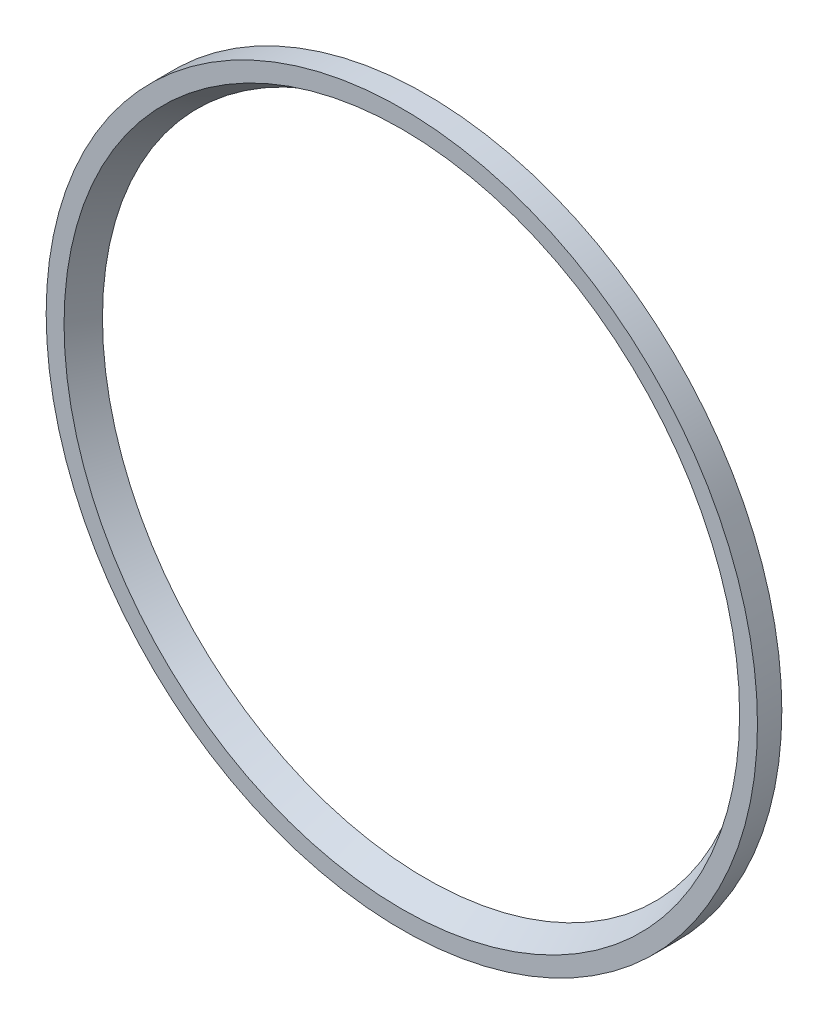
from build123d import *

# Parameters (mm, degrees)
SKETCH1_R           = 18.542
SKETCH1_R_2         = 16.51
BOSS_EXTRUDE1_DEPTH = 1.27
CHAMFER1_SIZE       = 1.905
CHAMFER1_SIZE_2     = 1.099852263


with BuildPart() as part:
    # Sketch1 → Boss-Extrude1 (new body)
    with BuildSketch(Plane.XY):
        Circle(SKETCH1_R)
        Circle(SKETCH1_R_2, mode=Mode.SUBTRACT)
    extrude(amount=BOSS_EXTRUDE1_DEPTH)

    # Chamfer1
    # the kernel refuses this chamfer: 1.905, 1.099852263 mm, written as the material it takes off along each edge
    with BuildSketch(Plane(origin=(0, 0, 1.27), x_dir=(1, 0, 0), z_dir=(0, -1, 0))) as chamfer1_piece_1:
        Polygon((16.51, -CHAMFER1_SIZE), (16.51 + CHAMFER1_SIZE_2, 0), (16.51, 0), align=None)
    revolve(axis=Axis((0, 0, 1.27), (0, 0, 1)), mode=Mode.SUBTRACT)


solid = part.part
